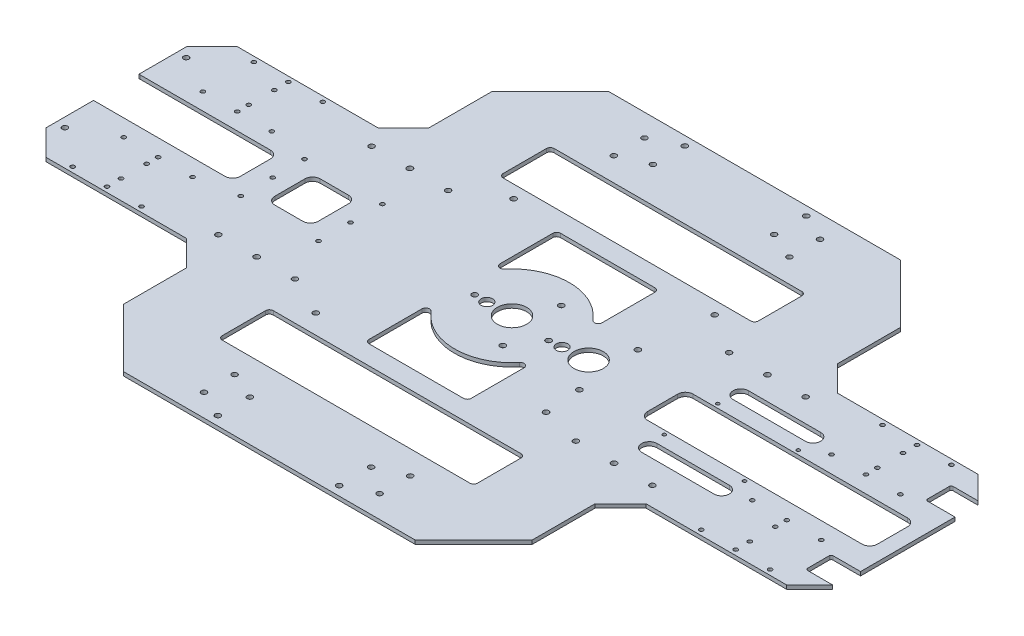
from build123d import *

# Parameters (mm, degrees)
EXTRUDE_1_DEPTH      = 3
CHAMFER_1_SIZE       = 20
SKETCH_2_W           = 320
SKETCH_2_H           = 20
CUT_EXTRUDE_1_DEPTH  = 5
CHAMFER_2_SIZE       = 50
SKETCH_3_R           = 2.1
SKETCH_3_R_2         = 2.099999999
SKETCH_3_R_3         = 2.100000001
CUT_EXTRUDE_2_DEPTH  = 80
SKETCH_4_R           = 2.15
CUT_EXTRUDE_3_DEPTH  = 10
SKETCH_5_R           = 1.6
SKETCH_5_R_2         = 2.1
SKETCH_5_R_3         = 2.2
CUT_EXTRUDE_4_DEPTH  = 29
EXTRUDE_2_DEPTH      = 3
SKETCH_7_W           = 23
SKETCH_7_H           = 20
CUT_EXTRUDE_5_DEPTH  = 3
FILLET_1_R           = 1.5
SKETCH_9_R           = 2.15
CUT_EXTRUDE_6_DEPTH  = 3
SKETCH_10_R          = 11.5
SKETCH_10_R_2        = 4.5
SKETCH_10_R_3        = 2.15
CUT_EXTRUDE_7_DEPTH  = 5
SKETCH_11_R          = 1.6
CUT_EXTRUDE_8_DEPTH  = 10
SKETCH_13_R          = 1.35
CUT_EXTRUDE_9_DEPTH  = 3
CUT_EXTRUDE_10_DEPTH = 3
CUT_EXTRUDE_START    = -3
SKETCH_15_R          = 2.15
SKETCH_15_R_2        = 4.5
SKETCH_15_R_3        = 11.5
CUT_EXTRUDE_11_DEPTH = 3
CUT_EXTRUDE_12_DEPTH = 3
CUT_EXTRUDE_13_DEPTH = 3


with BuildPart() as part:
    # 草图1 → 凸台-拉伸1 (new body)
    with BuildSketch(Plane(origin=(0, 0, 0), x_dir=(1, 0, 0), z_dir=(0, 1, 0))):
        Polygon((-310, -75), (-160, -75), (-160, -200), (160, -200), (160, -75), (310, -75), (310, 75), (160, 75), (160, 200), (-160, 200), (-160, 75), (-310, 75), align=None)
    extrude(amount=EXTRUDE_1_DEPTH)

    # 倒角1
    chamfer_1_edges = [part.edges().sort_by_distance(p)[0] for p in [
        (-160, 1.5, -75),
        (-310, 1.5, -75),
        (-310, 1.5, 75),
        (-160, 1.5, 75),
        (160, 1.5, 75),
        (160, 1.5, -75),
        (310, 1.5, 75),
        (310, 1.5, -75),
    ]]
    chamfer(chamfer_1_edges, length=CHAMFER_1_SIZE)

    # 草图2 → 切除-拉伸1 (cut)
    with BuildSketch(Plane(origin=(0, 3, 0), x_dir=(1, 0, 0), z_dir=(0, 1, 0))):
        with Locations((0, 190)):
            Rectangle(SKETCH_2_W, SKETCH_2_H)
        with Locations((0, -190)):
            Rectangle(SKETCH_2_W, SKETCH_2_H)
    extrude(amount=-CUT_EXTRUDE_1_DEPTH, mode=Mode.SUBTRACT)

    # 倒角2
    chamfer_2_edges = [part.edges().sort_by_distance(p)[0] for p in [
        (-160, 1.5, -180),
        (-160, 1.5, 180),
        (160, 1.5, -180),
        (160, 1.5, 180),
    ]]
    chamfer(chamfer_2_edges, length=CHAMFER_2_SIZE)

    # 草图3 → 切除-拉伸2 (cut)
    with BuildSketch(Plane(origin=(0, 3, 0), x_dir=(1, 0, 0), z_dir=(0, 1, 0))):
        with Locations((-327.700177837, 47.5)):
            Circle(SKETCH_3_R)
        with Locations((-302.700177837, 47.5)):
            Circle(SKETCH_3_R)
        with Locations((-47.5, 182.826293853)):
            Circle(SKETCH_3_R)
        with Locations((-47.5, 157.826293853)):
            Circle(SKETCH_3_R)
        with Locations((47.5, 182.826293853)):
            Circle(SKETCH_3_R)
        with Locations((47.5, 157.826293853)):
            Circle(SKETCH_3_R)
        with Locations((302.700177837, 47.5)):
            Circle(SKETCH_3_R_2)
        with Locations((327.700177837, 47.5)):
            Circle(SKETCH_3_R_2)
        with Locations((-68.75, 172.5)):
            Circle(SKETCH_3_R)
        with Locations((-68.75, 148.5)):
            Circle(SKETCH_3_R)
        with Locations((68.75, 172.5)):
            Circle(SKETCH_3_R)
        with Locations((68.75, 148.5)):
            Circle(SKETCH_3_R)
        with Locations((68.75, -148.5)):
            Circle(SKETCH_3_R)
        with Locations((68.75, -172.5)):
            Circle(SKETCH_3_R)
        with Locations((-68.75, -148.5)):
            Circle(SKETCH_3_R)
        with Locations((-68.75, -172.5)):
            Circle(SKETCH_3_R)
        with Locations((327.700177837, -47.5)):
            Circle(SKETCH_3_R_3)
        with Locations((302.700177837, -47.5)):
            Circle(SKETCH_3_R_3)
        with Locations((47.5, -157.826293853)):
            Circle(SKETCH_3_R)
        with Locations((47.5, -182.826293853)):
            Circle(SKETCH_3_R)
        with Locations((-47.5, -157.826293853)):
            Circle(SKETCH_3_R)
        with Locations((-47.5, -182.826293853)):
            Circle(SKETCH_3_R)
        with Locations((-302.700177837, -47.5)):
            Circle(SKETCH_3_R)
        with Locations((-327.700177837, -47.5)):
            Circle(SKETCH_3_R)
    extrude(amount=-CUT_EXTRUDE_2_DEPTH, mode=Mode.SUBTRACT)

    # 草图4 → 切除-拉伸3 (cut)
    with BuildSketch(Plane.XZ):
        with Locations((-78.739999994, 74.909999989)):
            Circle(SKETCH_4_R)
        with Locations((-78.739999994, -80.01)):
            Circle(SKETCH_4_R)
        with Locations((78.740000006, -80.01)):
            Circle(SKETCH_4_R)
        with Locations((78.740000006, 52.07)):
            Circle(SKETCH_4_R)
    extrude(amount=-CUT_EXTRUDE_3_DEPTH, mode=Mode.SUBTRACT)

    # 草图5 → 切除-拉伸4 (cut)
    with BuildSketch(Plane(origin=(0, 3, 0), x_dir=(1, 0, 0), z_dir=(0, 1, 0))):
        with Locations((219.200177837, 71)):
            Circle(SKETCH_5_R)
        with Locations((273.200177837, 71)):
            Circle(SKETCH_5_R)
        with Locations((246.200177837, 71)):
            Circle(SKETCH_5_R)
        with Locations((219.200177837, 30.998400192)):
            Circle(SKETCH_5_R)
        with Locations((246.200177837, 30.998400192)):
            Circle(SKETCH_5_R)
        with Locations((273.200177837, 30.998400192)):
            Circle(SKETCH_5_R)
        with Locations((246.200177837, 60)):
            Circle(SKETCH_5_R)
        with Locations((246.200177837, 40)):
            Circle(SKETCH_5_R)
        with Locations((246.200177837, -40)):
            Circle(SKETCH_5_R)
        with Locations((246.200177837, -60)):
            Circle(SKETCH_5_R)
        with Locations((273.200177837, -30.998400192)):
            Circle(SKETCH_5_R)
        with Locations((246.200177837, -30.998400192)):
            Circle(SKETCH_5_R)
        with Locations((219.200177837, -30.998400192)):
            Circle(SKETCH_5_R)
        with Locations((246.200177837, -71)):
            Circle(SKETCH_5_R)
        with Locations((273.200177837, -71)):
            Circle(SKETCH_5_R)
        with Locations((219.200177837, -71)):
            Circle(SKETCH_5_R)
        with Locations((-219.200177837, -71)):
            Circle(SKETCH_5_R)
        with Locations((-273.200177837, -71)):
            Circle(SKETCH_5_R)
        with Locations((-246.200177837, -71)):
            Circle(SKETCH_5_R)
        with Locations((-219.200177837, -30.998400192)):
            Circle(SKETCH_5_R)
        with Locations((-246.200177837, -30.998400192)):
            Circle(SKETCH_5_R)
        with Locations((-273.200177837, -30.998400192)):
            Circle(SKETCH_5_R)
        with Locations((-246.200177837, -60)):
            Circle(SKETCH_5_R)
        with Locations((-246.200177837, -40)):
            Circle(SKETCH_5_R)
        with Locations((-246.200177837, 40)):
            Circle(SKETCH_5_R)
        with Locations((-246.200177837, 60)):
            Circle(SKETCH_5_R)
        with Locations((-273.200177837, 30.998400192)):
            Circle(SKETCH_5_R)
        with Locations((-246.200177837, 30.998400192)):
            Circle(SKETCH_5_R)
        with Locations((-219.200177837, 30.998400192)):
            Circle(SKETCH_5_R)
        with Locations((-246.200177837, 71)):
            Circle(SKETCH_5_R)
        with Locations((-273.200177837, 71)):
            Circle(SKETCH_5_R)
        with Locations((-219.200177837, 71)):
            Circle(SKETCH_5_R)
        with Locations((170, -60)):
            Circle(SKETCH_5_R_2)
        with Locations((110, -60)):
            Circle(SKETCH_5_R_2)
        with Locations((140, -60)):
            Circle(SKETCH_5_R_3)
        with Locations((140, 60)):
            Circle(SKETCH_5_R_3)
        with Locations((110, 60)):
            Circle(SKETCH_5_R_2)
        with Locations((170, 60)):
            Circle(SKETCH_5_R_2)
        with Locations((-170, 60)):
            Circle(SKETCH_5_R_2)
        with Locations((-110, 60)):
            Circle(SKETCH_5_R_2)
        with Locations((-140, 60)):
            Circle(SKETCH_5_R_3)
        with Locations((-140, -60)):
            Circle(SKETCH_5_R_3)
        with Locations((-110, -60)):
            Circle(SKETCH_5_R_2)
        with Locations((-170, -60)):
            Circle(SKETCH_5_R_2)
    extrude(amount=-CUT_EXTRUDE_4_DEPTH, mode=Mode.SUBTRACT)

    # 草图6 → 凸台-拉伸2 (add)
    with BuildSketch(Plane(origin=(0, 3, 0), x_dir=(1, 0, 0), z_dir=(0, 1, 0))):
        Polygon((-160, 144.142135624), (-160, 130), (-110, 180), (110, 180), (160, 130), (160, 144.142135624), (114.142135624, 190), (-114.142135624, 190), align=None)
        Polygon((114.142135624, -190), (160, -144.142135624), (160, -130), (110, -180), (-110, -180), (-160, -130), (-160, -144.142135624), (-114.142135624, -190), align=None)
    extrude(amount=-EXTRUDE_2_DEPTH)

    # 草图7 → 切除-拉伸5 (cut)
    with BuildSketch(Plane(origin=(0, 3, 0), x_dir=(1, 0, 0), z_dir=(0, 1, 0))):
        with Locations((298.5, 47)):
            Rectangle(SKETCH_7_W, SKETCH_7_H)
        with Locations((298.5, -47)):
            Rectangle(SKETCH_7_W, SKETCH_7_H)
    extrude(amount=-CUT_EXTRUDE_5_DEPTH, mode=Mode.SUBTRACT)

    # 圆角1
    fillet_1_edges = [part.edges().sort_by_distance(p)[0] for p in [
        (287, 1.5, 37),
        (287, 1.5, 57),
        (287, 1.5, -37),
        (287, 1.5, -57),
    ]]
    fillet(fillet_1_edges, radius=FILLET_1_R)

    # 草图9 → 切除-拉伸6 (cut)
    with BuildSketch(Plane.XZ):
        with Locations((-47.5, 182.87842708)):
            Circle(SKETCH_9_R)
        with Locations((47.5, 182.87842708)):
            Circle(SKETCH_9_R)
        with Locations((47.5, -182.87842708)):
            Circle(SKETCH_9_R)
        with Locations((-47.5, -182.87842708)):
            Circle(SKETCH_9_R)
    extrude(amount=-CUT_EXTRUDE_6_DEPTH, mode=Mode.SUBTRACT)

    # 草图10 → 切除-拉伸7 (cut)
    with BuildSketch(Plane.XZ):
        with Locations((60, 0)):
            Circle(SKETCH_10_R)
        with Locations((40.818485661, 1.62234634)):
            Circle(SKETCH_10_R_2)
        with Locations((72.33180035, -26.247413208)):
            Circle(SKETCH_10_R_3)
        with Locations((76.565026447, 23.803358982)):
            Circle(SKETCH_10_R_3)
        with Locations((31.103173203, 2.444054227)):
            Circle(SKETCH_10_R_3)
    extrude(amount=-CUT_EXTRUDE_7_DEPTH, mode=Mode.SUBTRACT)

    # 草图11 → 切除-拉伸8 (cut)
    with BuildSketch(Plane.XZ):
        with Locations((-126.5, -25)):
            Circle(SKETCH_11_R)
        with Locations((-187.5, -25)):
            Circle(SKETCH_11_R)
        with Locations((-126.5, 0)):
            Circle(SKETCH_11_R)
        with Locations((-187.4745166, 0)):
            Circle(SKETCH_11_R)
        with Locations((-187.4745166, 25)):
            Circle(SKETCH_11_R)
        with Locations((-126.5, 25)):
            Circle(SKETCH_11_R)
    extrude(amount=-CUT_EXTRUDE_8_DEPTH, mode=Mode.SUBTRACT)

    # 草图13 → 切除-拉伸9 (cut)
    with BuildSketch(Plane(origin=(0, 3, 0), x_dir=(1, 0, 0), z_dir=(0, 1, 0))):
        with Locations((140.200177837, 21)):
            Circle(SKETCH_13_R)
        with Locations((203.200177837, 21)):
            Circle(SKETCH_13_R)
        with Locations((203.200177837, -21)):
            Circle(SKETCH_13_R)
        with Locations((140.200177837, -21)):
            Circle(SKETCH_13_R)
        with BuildLine():
            Line((143.400177837, 41.8), (200.000177837, 41.8))
            ThreePointArc((200.000177837, 41.8), (206.000177837, 35.8), (200.000177837, 29.8))
            Line((200.000177837, 29.8), (143.400177837, 29.8))
            ThreePointArc((143.400177837, 29.8), (137.400177837, 35.8), (143.400177837, 41.8))
        make_face()
        with BuildLine():
            Line((143.400177837, -29.8), (200.000177837, -29.8))
            ThreePointArc((200.000177837, -29.8), (206.000177837, -35.8), (200.000177837, -41.8))
            Line((200.000177837, -41.8), (143.400177837, -41.8))
            ThreePointArc((143.400177837, -41.8), (137.400177837, -35.8), (143.400177837, -29.8))
        make_face()
    extrude(amount=-CUT_EXTRUDE_9_DEPTH, mode=Mode.SUBTRACT)

    # 草图14 → 切除-拉伸10 (cut)
    with BuildSketch(Plane(origin=(0, 3, 0), x_dir=(1, 0, 0), z_dir=(0, 1, 0))):
        with BuildLine():
            Line((292, 17.8), (124, 17.8))
            ThreePointArc((124, 17.8), (119.757359313, 16.042640687), (118, 11.8))
            Line((118, 11.8), (118, -11.8))
            ThreePointArc((118, -11.8), (119.757359313, -16.042640687), (124, -17.8))
            Line((124, -17.8), (292, -17.8))
            ThreePointArc((292, -17.8), (296.242640687, -16.042640687), (298, -11.8))
            Line((298, -11.8), (298, 11.8))
            ThreePointArc((298, 11.8), (296.242640687, 16.042640687), (292, 17.8))
        make_face()
    extrude(amount=-CUT_EXTRUDE_10_DEPTH, mode=Mode.SUBTRACT)

    # 草图15 → 切除-拉伸11 (cut)
    with BuildSketch(Plane(origin=(0, 3, 0), x_dir=(1, 0, 0), z_dir=(0, 1, 0)).offset(CUT_EXTRUDE_START)):
        with Locations((76.565026447, -23.803358982)):
            Circle(SKETCH_15_R)
        with Locations((72.33180035, 26.247413208)):
            Circle(SKETCH_15_R)
        with Locations((31.103173203, -2.444054227)):
            Circle(SKETCH_15_R)
        with Locations((40.818485661, -1.62234634)):
            Circle(SKETCH_15_R_2)
        with Locations((60, 0)):
            Circle(SKETCH_15_R_3)
        with Locations((16.565026447, -23.803358982)):
            Circle(SKETCH_15_R)
        with Locations((12.33180035, 26.247413208)):
            Circle(SKETCH_15_R)
        with Locations((-28.896826797, -0.34594168)):
            Circle(SKETCH_15_R)
        with Locations((-19.181514339, -0.523817525)):
            Circle(SKETCH_15_R_2)
        Circle(SKETCH_15_R_3)
    extrude(amount=CUT_EXTRUDE_11_DEPTH, mode=Mode.SUBTRACT)

    # 草图16 → 切除-拉伸12 (cut)
    with BuildSketch(Plane(origin=(0, 3, 0), x_dir=(1, 0, 0), z_dir=(0, 1, 0))):
        with BuildLine():
            Line((97, 130), (-97, 130))
            ThreePointArc((-97, 130), (-99.121320344, 129.121320344), (-100, 127))
            Line((-100, 127), (-100, 93))
            ThreePointArc((-100, 93), (-99.121320344, 90.878679656), (-97, 90))
            Line((-97, 90), (97, 90))
            ThreePointArc((97, 90), (99.121320344, 90.878679656), (100, 93))
            Line((100, 93), (100, 127))
            ThreePointArc((100, 127), (99.121320344, 129.121320344), (97, 130))
        make_face()
        with BuildLine():
            Line((97, -90), (-97, -90))
            ThreePointArc((-97, -90), (-99.121320344, -90.878679656), (-100, -93))
            Line((-100, -93), (-100, -127))
            ThreePointArc((-100, -127), (-99.121320344, -129.121320344), (-97, -130))
            Line((-97, -130), (97, -130))
            ThreePointArc((97, -130), (99.121320344, -129.121320344), (100, -127))
            Line((100, -127), (100, -93))
            ThreePointArc((100, -93), (99.121320344, -90.878679656), (97, -90))
        make_face()
        with BuildLine():
            ThreePointArc((-37, 75), (-39.121320344, 74.121320344), (-40, 72))
            Line((-40, 72), (-40, 30.577769703))
            ThreePointArc((-40, 30.577769703), (-38.015504801, 27.754872255), (-34.6875, 28.666659096))
            ThreePointArc((-34.6875, 28.666659096), (0, 45), (34.6875, 28.666659096))
            ThreePointArc((34.6875, 28.666659096), (38.015504801, 27.754872255), (40, 30.577769703))
            Line((40, 30.577769703), (40, 72))
            ThreePointArc((40, 72), (39.121320344, 74.121320344), (37, 75))
            Line((37, 75), (-37, 75))
        make_face()
        with BuildLine():
            ThreePointArc((-34.6875, -28.666659096), (-38.015504801, -27.754872255), (-40, -30.577769703))
            Line((-40, -30.577769703), (-40, -72))
            ThreePointArc((-40, -72), (-39.121320344, -74.121320344), (-37, -75))
            Line((-37, -75), (37, -75))
            ThreePointArc((37, -75), (39.121320344, -74.121320344), (40, -72))
            Line((40, -72), (40, -30.577769703))
            ThreePointArc((40, -30.577769703), (38.015504801, -27.754872255), (34.6875, -28.666659096))
            ThreePointArc((34.6875, -28.666659096), (0, -45), (-34.6875, -28.666659096))
        make_face()
    extrude(amount=-CUT_EXTRUDE_12_DEPTH, mode=Mode.SUBTRACT)

    # 草图17 → 切除-拉伸13 (cut)
    with BuildSketch(Plane(origin=(0, 3, 0), x_dir=(1, 0, 0), z_dir=(0, 1, 0))):
        with BuildLine():
            Line((-308.827907457, 17.8), (-207, 17.8))
            ThreePointArc((-207, 17.8), (-202.757359313, 16.042640687), (-201, 11.8))
            Line((-201, 11.8), (-201, -11.8))
            ThreePointArc((-201, -11.8), (-202.757359313, -16.042640687), (-207, -17.8))
            Line((-207, -17.8), (-308.827907457, -17.8))
            ThreePointArc((-308.827907457, -17.8), (-313.070548144, -16.042640687), (-314.827907457, -11.8))
            Line((-314.827907457, -11.8), (-314.827907457, 11.8))
            ThreePointArc((-314.827907457, 11.8), (-313.070548144, 16.042640687), (-308.827907457, 17.8))
        make_face()
        with BuildLine():
            Line((-168, 17.8), (-146, 17.8))
            ThreePointArc((-146, 17.8), (-141.757359313, 16.042640687), (-140, 11.8))
            Line((-140, 11.8), (-140, -11.8))
            ThreePointArc((-140, -11.8), (-141.757359313, -16.042640687), (-146, -17.8))
            Line((-146, -17.8), (-168, -17.8))
            ThreePointArc((-168, -17.8), (-172.242640687, -16.042640687), (-174, -11.8))
            Line((-174, -11.8), (-174, 11.8))
            ThreePointArc((-174, 11.8), (-172.242640687, 16.042640687), (-168, 17.8))
        make_face()
    extrude(amount=-CUT_EXTRUDE_13_DEPTH, mode=Mode.SUBTRACT)


solid = part.part
